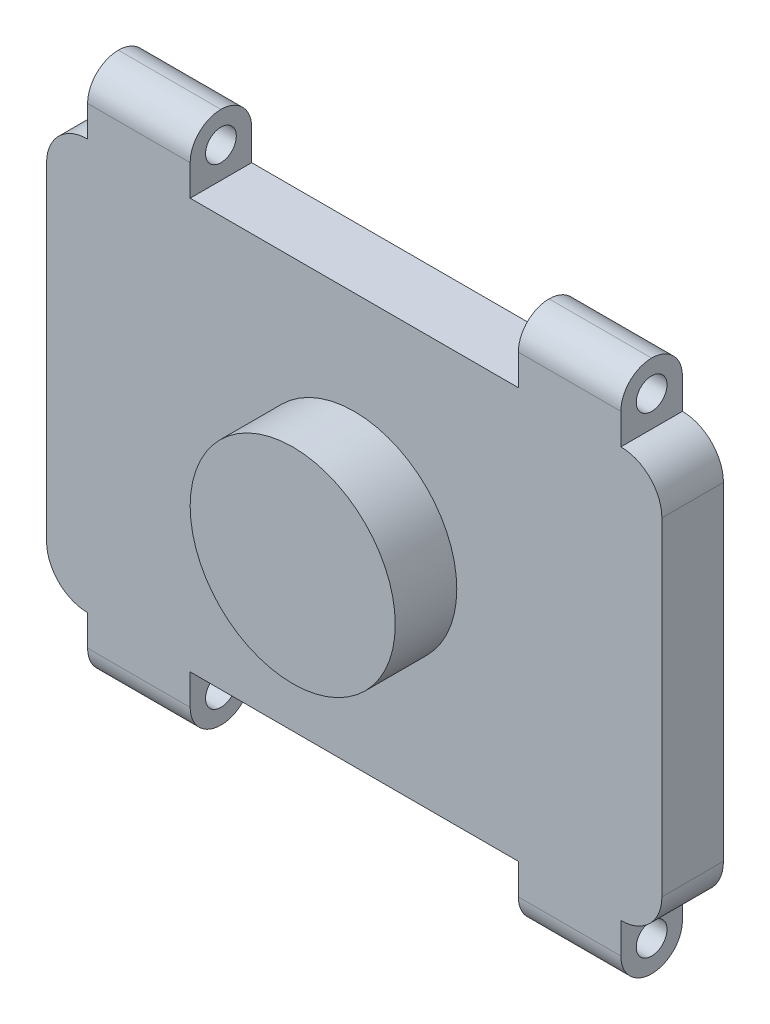
from build123d import *

# Parameters (mm, degrees)
IZIM1_W                     = 3000
IZIM1_H                     = 2000
Y_KSEKLIK_EKSTR_ZYON1_DEPTH = 300
RADYUS1_R                   = 200
IZIM2_W                     = 500
IZIM2_H                     = 300
Y_KSEKLIK_EKSTR_ZYON2_DEPTH = 300
IZIM3_R                     = 75
KES_EKSTR_ZYON1_DEPTH       = 3686
RADYUS2_R                   = 150
IZIM4_R                     = 500
Y_KSEKLIK_EKSTR_ZYON3_DEPTH = 300


with BuildPart() as part:
    # Çizim1 → Yükseklik-Ekstrüzyon1 (new body)
    with BuildSketch(Plane.XY):
        with Locations((-154.847360295, -129.353233831)):
            Rectangle(IZIM1_W, IZIM1_H)
    extrude(amount=Y_KSEKLIK_EKSTR_ZYON1_DEPTH)

    # Radyus1
    radyus1_edges = [part.edges().sort_by_distance(p)[0] for p in [
        (-1654.847360295, 870.646766169, 150),
        (1345.152639705, 870.646766169, 150),
        (1345.152639705, -1129.353233831, 150),
        (-1654.847360295, -1129.353233831, 150),
    ]]
    fillet(radyus1_edges, radius=RADYUS1_R)

    # Çizim2 → Yükseklik-Ekstrüzyon2 (add)
    with BuildSketch(Plane.XY.offset(300)):
        with Locations((-1204.847360295, 1020.646766169)):
            Rectangle(IZIM2_W, IZIM2_H)
        with Locations((895.152639705, 1020.646766169)):
            Rectangle(IZIM2_W, IZIM2_H)
        with Locations((895.152639705, -1279.353233831)):
            Rectangle(IZIM2_W, IZIM2_H)
        with Locations((-1204.847360295, -1279.353233831)):
            Rectangle(IZIM2_W, IZIM2_H)
    extrude(amount=-Y_KSEKLIK_EKSTR_ZYON2_DEPTH)

    # Çizim3 → Kes-Ekstrüzyon1 (cut)
    with BuildSketch(Plane(origin=(1345.152639705, 0, 0), x_dir=(0, 0, -1), z_dir=(1, 0, 0))):
        with Locations(Location((-150, 1020.646766169, 0), (0, 0, 180))):
            Circle(IZIM3_R)
        with Locations((-150, -1279.353233831)):
            Circle(IZIM3_R)
    extrude(amount=-KES_EKSTR_ZYON1_DEPTH, mode=Mode.SUBTRACT)

    # Radyus2
    radyus2_edges = [part.edges().sort_by_distance(p)[0] for p in [
        (-1204.847360295, -1429.353233831, 300),
        (-1204.847360295, -1429.353233831, 0),
        (895.152639705, -1429.353233831, 300),
        (895.152639705, -1429.353233831, 0),
        (895.152639705, 1170.646766169, 300),
        (895.152639705, 1170.646766169, 0),
        (-1204.847360295, 1170.646766169, 300),
        (-1204.847360295, 1170.646766169, 0),
    ]]
    fillet(radyus2_edges, radius=RADYUS2_R - 0.0001)  # a hair under: the kernel refuses the full size

    # Çizim4 → Yükseklik-Ekstrüzyon3 (add)
    with BuildSketch(Plane.XY.offset(300)):
        with Locations((-154.847360295, -129.353233831)):
            Circle(IZIM4_R)
    extrude(amount=Y_KSEKLIK_EKSTR_ZYON3_DEPTH)


solid = part.part
